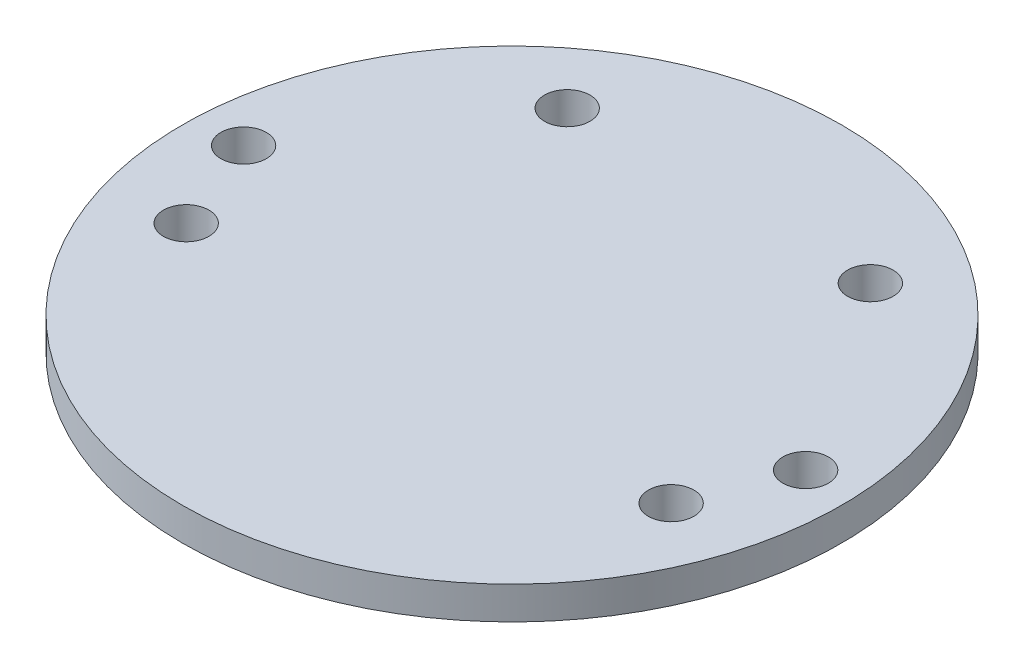
from build123d import *

# Parameters (mm, degrees)
SKETCH1_R           = 50.292
SKETCH1_R_2         = 3.475
BOSS_EXTRUDE1_DEPTH = 5


with BuildPart() as part:
    # Sketch1 → Boss-Extrude1 (new body)
    with BuildSketch(Plane(origin=(0, 0, 0), x_dir=(1, 0, 0), z_dir=(0, 1, 0))):
        Circle(SKETCH1_R)
        with Locations((-37.000474826, -12.718618748)):
            Circle(SKETCH1_R_2, mode=Mode.SUBTRACT)
        with Locations((37.000474826, -12.718618748)):
            Circle(SKETCH1_R_2, mode=Mode.SUBTRACT)
        with Locations((-42.886820356, 1.924977859)):
            Circle(SKETCH1_R_2, mode=Mode.SUBTRACT)
        with Locations((-23.129730363, 31.556520301)):
            Circle(SKETCH1_R_2, mode=Mode.SUBTRACT)
        with Locations((42.886820356, 1.924977859)):
            Circle(SKETCH1_R_2, mode=Mode.SUBTRACT)
        with Locations((23.129730363, 31.556520301)):
            Circle(SKETCH1_R_2, mode=Mode.SUBTRACT)
    extrude(amount=BOSS_EXTRUDE1_DEPTH)


solid = part.part
